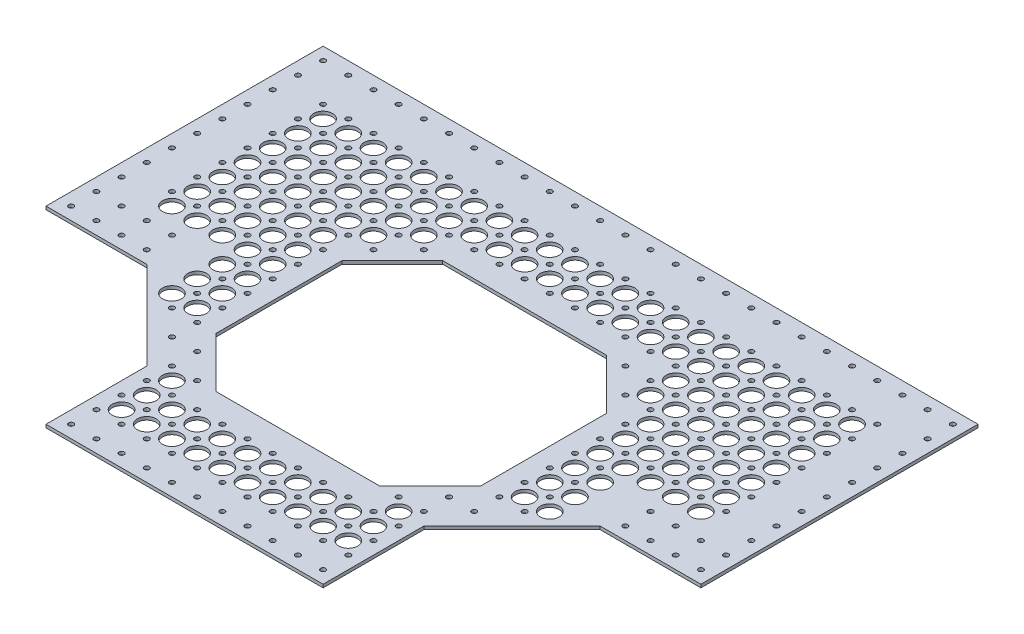
from build123d import *

# Parameters (mm, degrees)
SKETCH1_R           = 2.54
BOSS_EXTRUDE1_DEPTH = 3.175
SKETCH2_W           = 762
SKETCH2_H           = 25.4
CUT_EXTRUDE1_DEPTH  = 241.3
SKETCH3_W           = 266.7
SKETCH3_H           = 177.8
CUT_EXTRUDE2_DEPTH  = 3.175
BOSS_EXTRUDE2_DEPTH = 3.175
CUT_EXTRUDE3_DEPTH  = 3.175
SKETCH8_R           = 2.54
SKETCH8_R_2         = 9.525
CUT_EXTRUDE5_DEPTH  = 3.175


with BuildPart() as part:
    # Sketch1 → Boss-Extrude1 (new body)
    with BuildSketch(Plane(origin=(0, 0, 0), x_dir=(1, 0, 0), z_dir=(0, 1, 0))):
        Polygon((0, 101.6), (0, 0), (-88.904535599, -88.904535599), (-177.804535599, -88.904535599), (-190.504535599, -88.904535599), (-190.504535599, -419.104535599), (-177.804535599, -419.104535599), (-88.904535599, -419.104535599), (0, -508.009071197), (0, -609.609071197), (279.4, -609.609071197), (279.4, -508.009071197), (368.304535599, -419.104535599), (469.904535599, -419.104535599), (469.904535599, -88.904535599), (368.304535599, -88.904535599), (279.4, 0), (279.4, 101.6), align=None)
        with Locations((12.7, -596.909071197)):
            Circle(SKETCH1_R, mode=Mode.SUBTRACT)
        with Locations((38.1, -596.909071197)):
            Circle(SKETCH1_R, mode=Mode.SUBTRACT)
        with Locations((63.5, -596.909071197)):
            Circle(SKETCH1_R, mode=Mode.SUBTRACT)
        with Locations((88.9, -596.909071197)):
            Circle(SKETCH1_R, mode=Mode.SUBTRACT)
        with Locations((114.3, -596.909071197)):
            Circle(SKETCH1_R, mode=Mode.SUBTRACT)
        with Locations((139.7, -596.909071197)):
            Circle(SKETCH1_R, mode=Mode.SUBTRACT)
        with Locations((-177.804535599, -406.404535599)):
            Circle(SKETCH1_R, mode=Mode.SUBTRACT)
        with Locations((-152.404535599, -406.404535599)):
            Circle(SKETCH1_R, mode=Mode.SUBTRACT)
        with Locations((-127.004535599, -406.404535599)):
            Circle(SKETCH1_R, mode=Mode.SUBTRACT)
        with Locations((-177.804535599, -381.004535599)):
            Circle(SKETCH1_R, mode=Mode.SUBTRACT)
        with Locations((-152.404535599, -381.004535599)):
            Circle(SKETCH1_R, mode=Mode.SUBTRACT)
        with Locations((-177.804535599, -355.604535599)):
            Circle(SKETCH1_R, mode=Mode.SUBTRACT)
        with Locations((-127.004535599, -381.004535599)):
            Circle(SKETCH1_R, mode=Mode.SUBTRACT)
        with Locations((-101.604535599, -406.404535599)):
            Circle(SKETCH1_R, mode=Mode.SUBTRACT)
        with Locations((-101.604535599, -381.004535599)):
            Circle(SKETCH1_R, mode=Mode.SUBTRACT)
        with Locations((-177.804535599, -330.204535599)):
            Circle(SKETCH1_R, mode=Mode.SUBTRACT)
        with Locations((-177.804535599, -304.804535599)):
            Circle(SKETCH1_R, mode=Mode.SUBTRACT)
        with Locations((-177.804535599, -279.404535599)):
            Circle(SKETCH1_R, mode=Mode.SUBTRACT)
        with Locations((165.1, -596.909071197)):
            Circle(SKETCH1_R, mode=Mode.SUBTRACT)
        with Locations((190.5, -596.909071197)):
            Circle(SKETCH1_R, mode=Mode.SUBTRACT)
        with Locations((215.9, -596.909071197)):
            Circle(SKETCH1_R, mode=Mode.SUBTRACT)
        with Locations((241.3, -596.909071197)):
            Circle(SKETCH1_R, mode=Mode.SUBTRACT)
        with Locations((266.7, -596.909071197)):
            Circle(SKETCH1_R, mode=Mode.SUBTRACT)
        with Locations((381.004535599, -406.404535599)):
            Circle(SKETCH1_R, mode=Mode.SUBTRACT)
        with Locations((381.004535599, -381.004535599)):
            Circle(SKETCH1_R, mode=Mode.SUBTRACT)
        with Locations((406.404535599, -406.404535599)):
            Circle(SKETCH1_R, mode=Mode.SUBTRACT)
        with Locations((431.804535599, -406.404535599)):
            Circle(SKETCH1_R, mode=Mode.SUBTRACT)
        with Locations((457.204535599, -406.404535599)):
            Circle(SKETCH1_R, mode=Mode.SUBTRACT)
        with Locations((406.404535599, -381.004535599)):
            Circle(SKETCH1_R, mode=Mode.SUBTRACT)
        with Locations((431.804535599, -381.004535599)):
            Circle(SKETCH1_R, mode=Mode.SUBTRACT)
        with Locations((457.204535599, -381.004535599)):
            Circle(SKETCH1_R, mode=Mode.SUBTRACT)
        with Locations((457.204535599, -355.604535599)):
            Circle(SKETCH1_R, mode=Mode.SUBTRACT)
        with Locations((457.204535599, -330.204535599)):
            Circle(SKETCH1_R, mode=Mode.SUBTRACT)
        with Locations((457.204535599, -304.804535599)):
            Circle(SKETCH1_R, mode=Mode.SUBTRACT)
        with Locations((457.204535599, -279.404535599)):
            Circle(SKETCH1_R, mode=Mode.SUBTRACT)
        with Locations((-177.804535599, -254.004535599)):
            Circle(SKETCH1_R, mode=Mode.SUBTRACT)
        with Locations((-177.804535599, -228.604535599)):
            Circle(SKETCH1_R, mode=Mode.SUBTRACT)
        with Locations((-177.804535599, -203.204535599)):
            Circle(SKETCH1_R, mode=Mode.SUBTRACT)
        with Locations((-177.804535599, -177.804535599)):
            Circle(SKETCH1_R, mode=Mode.SUBTRACT)
        with Locations((-177.804535599, -152.404535599)):
            Circle(SKETCH1_R, mode=Mode.SUBTRACT)
        with Locations((-152.404535599, -152.404535599)):
            Circle(SKETCH1_R, mode=Mode.SUBTRACT)
        with Locations((-177.804535599, -127.004535599)):
            Circle(SKETCH1_R, mode=Mode.SUBTRACT)
        with Locations((-152.404535599, -127.004535599)):
            Circle(SKETCH1_R, mode=Mode.SUBTRACT)
        with Locations((-127.004535599, -152.404535599)):
            Circle(SKETCH1_R, mode=Mode.SUBTRACT)
        with Locations((-127.004535599, -127.004535599)):
            Circle(SKETCH1_R, mode=Mode.SUBTRACT)
        with Locations((-177.804535599, -101.604535599)):
            Circle(SKETCH1_R, mode=Mode.SUBTRACT)
        with Locations((-101.604535599, -152.404535599)):
            Circle(SKETCH1_R, mode=Mode.SUBTRACT)
        with Locations((-76.204535599, -152.404535599)):
            Circle(SKETCH1_R, mode=Mode.SUBTRACT)
        with Locations((-101.604535599, -127.004535599)):
            Circle(SKETCH1_R, mode=Mode.SUBTRACT)
        with Locations((-76.204535599, -127.004535599)):
            Circle(SKETCH1_R, mode=Mode.SUBTRACT)
        with Locations((-50.804535599, -152.404535599)):
            Circle(SKETCH1_R, mode=Mode.SUBTRACT)
        with Locations((-25.404535599, -152.404535599)):
            Circle(SKETCH1_R, mode=Mode.SUBTRACT)
        with Locations((-50.804535599, -127.004535599)):
            Circle(SKETCH1_R, mode=Mode.SUBTRACT)
        with Locations((-25.404535599, -127.004535599)):
            Circle(SKETCH1_R, mode=Mode.SUBTRACT)
        with Locations((-0.004535599, -152.404535599)):
            Circle(SKETCH1_R, mode=Mode.SUBTRACT)
        with Locations((-0.004535599, -127.004535599)):
            Circle(SKETCH1_R, mode=Mode.SUBTRACT)
        with Locations((25.395464401, -152.404535599)):
            Circle(SKETCH1_R, mode=Mode.SUBTRACT)
        with Locations((50.795464401, -152.404535599)):
            Circle(SKETCH1_R, mode=Mode.SUBTRACT)
        with Locations((25.395464401, -127.004535599)):
            Circle(SKETCH1_R, mode=Mode.SUBTRACT)
        with Locations((50.795464401, -127.004535599)):
            Circle(SKETCH1_R, mode=Mode.SUBTRACT)
        with Locations((76.195464401, -152.404535599)):
            Circle(SKETCH1_R, mode=Mode.SUBTRACT)
        with Locations((76.195464401, -127.004535599)):
            Circle(SKETCH1_R, mode=Mode.SUBTRACT)
        with Locations((101.595464401, -152.404535599)):
            Circle(SKETCH1_R, mode=Mode.SUBTRACT)
        with Locations((126.995464401, -152.404535599)):
            Circle(SKETCH1_R, mode=Mode.SUBTRACT)
        with Locations((101.595464401, -127.004535599)):
            Circle(SKETCH1_R, mode=Mode.SUBTRACT)
        with Locations((126.995464401, -127.004535599)):
            Circle(SKETCH1_R, mode=Mode.SUBTRACT)
        with Locations((12.7, 88.9)):
            Circle(SKETCH1_R, mode=Mode.SUBTRACT)
        with Locations((38.1, 88.9)):
            Circle(SKETCH1_R, mode=Mode.SUBTRACT)
        with Locations((63.5, 88.9)):
            Circle(SKETCH1_R, mode=Mode.SUBTRACT)
        with Locations((88.9, 88.9)):
            Circle(SKETCH1_R, mode=Mode.SUBTRACT)
        with Locations((114.3, 88.9)):
            Circle(SKETCH1_R, mode=Mode.SUBTRACT)
        with Locations((139.7, 88.9)):
            Circle(SKETCH1_R, mode=Mode.SUBTRACT)
        with Locations((152.395464401, -152.404535599)):
            Circle(SKETCH1_R, mode=Mode.SUBTRACT)
        with Locations((177.795464401, -152.404535599)):
            Circle(SKETCH1_R, mode=Mode.SUBTRACT)
        with Locations((152.395464401, -127.004535599)):
            Circle(SKETCH1_R, mode=Mode.SUBTRACT)
        with Locations((177.795464401, -127.004535599)):
            Circle(SKETCH1_R, mode=Mode.SUBTRACT)
        with Locations((203.195464401, -152.404535599)):
            Circle(SKETCH1_R, mode=Mode.SUBTRACT)
        with Locations((203.195464401, -127.004535599)):
            Circle(SKETCH1_R, mode=Mode.SUBTRACT)
        with Locations((228.595464401, -152.404535599)):
            Circle(SKETCH1_R, mode=Mode.SUBTRACT)
        with Locations((253.995464401, -152.404535599)):
            Circle(SKETCH1_R, mode=Mode.SUBTRACT)
        with Locations((228.595464401, -127.004535599)):
            Circle(SKETCH1_R, mode=Mode.SUBTRACT)
        with Locations((253.995464401, -127.004535599)):
            Circle(SKETCH1_R, mode=Mode.SUBTRACT)
        with Locations((279.395464401, -152.404535599)):
            Circle(SKETCH1_R, mode=Mode.SUBTRACT)
        with Locations((304.795464401, -152.404535599)):
            Circle(SKETCH1_R, mode=Mode.SUBTRACT)
        with Locations((279.395464401, -127.004535599)):
            Circle(SKETCH1_R, mode=Mode.SUBTRACT)
        with Locations((304.795464401, -127.004535599)):
            Circle(SKETCH1_R, mode=Mode.SUBTRACT)
        with Locations((457.204535599, -254.004535599)):
            Circle(SKETCH1_R, mode=Mode.SUBTRACT)
        with Locations((457.204535599, -228.604535599)):
            Circle(SKETCH1_R, mode=Mode.SUBTRACT)
        with Locations((457.204535599, -203.204535599)):
            Circle(SKETCH1_R, mode=Mode.SUBTRACT)
        with Locations((457.204535599, -177.804535599)):
            Circle(SKETCH1_R, mode=Mode.SUBTRACT)
        with Locations((330.195464401, -152.404535599)):
            Circle(SKETCH1_R, mode=Mode.SUBTRACT)
        with Locations((330.195464401, -127.004535599)):
            Circle(SKETCH1_R, mode=Mode.SUBTRACT)
        with Locations((355.595464401, -152.404535599)):
            Circle(SKETCH1_R, mode=Mode.SUBTRACT)
        with Locations((380.995464401, -152.404535599)):
            Circle(SKETCH1_R, mode=Mode.SUBTRACT)
        with Locations((355.595464401, -127.004535599)):
            Circle(SKETCH1_R, mode=Mode.SUBTRACT)
        with Locations((380.995464401, -127.004535599)):
            Circle(SKETCH1_R, mode=Mode.SUBTRACT)
        with Locations((406.395464401, -152.404535599)):
            Circle(SKETCH1_R, mode=Mode.SUBTRACT)
        with Locations((406.395464401, -127.004535599)):
            Circle(SKETCH1_R, mode=Mode.SUBTRACT)
        with Locations((431.795464401, -152.404535599)):
            Circle(SKETCH1_R, mode=Mode.SUBTRACT)
        with Locations((457.204535599, -152.404535599)):
            Circle(SKETCH1_R, mode=Mode.SUBTRACT)
        with Locations((431.795464401, -127.004535599)):
            Circle(SKETCH1_R, mode=Mode.SUBTRACT)
        with Locations((457.204535599, -127.004535599)):
            Circle(SKETCH1_R, mode=Mode.SUBTRACT)
        with Locations((457.204535599, -101.604535599)):
            Circle(SKETCH1_R, mode=Mode.SUBTRACT)
        with Locations((165.1, 88.9)):
            Circle(SKETCH1_R, mode=Mode.SUBTRACT)
        with Locations((190.5, 88.9)):
            Circle(SKETCH1_R, mode=Mode.SUBTRACT)
        with Locations((215.9, 88.9)):
            Circle(SKETCH1_R, mode=Mode.SUBTRACT)
        with Locations((241.3, 88.9)):
            Circle(SKETCH1_R, mode=Mode.SUBTRACT)
        with Locations((266.7, 88.9)):
            Circle(SKETCH1_R, mode=Mode.SUBTRACT)
    extrude(amount=BOSS_EXTRUDE1_DEPTH)

    # Sketch2 → Cut-Extrude1 (cut)
    with BuildSketch(Plane(origin=(0, 0, -101.6), x_dir=(-1, 0, 0), z_dir=(0, 0, -1))):
        with Locations((-129.535464401, 0)):
            Rectangle(SKETCH2_W, SKETCH2_H)
    extrude(amount=-CUT_EXTRUDE1_DEPTH, mode=Mode.SUBTRACT)

    # Sketch3 → Cut-Extrude2 (cut)
    with BuildSketch(Plane(origin=(0, 3.175, 0), x_dir=(1, 0, 0), z_dir=(0, 1, 0))):
        with Locations((139.7, -406.404535599)):
            Rectangle(SKETCH3_W, SKETCH3_H)
    extrude(amount=-CUT_EXTRUDE2_DEPTH, mode=Mode.SUBTRACT)

    # Sketch4 → Boss-Extrude2 (add)
    with BuildSketch(Plane(origin=(0, 3.175, 0), x_dir=(1, 0, 0), z_dir=(0, 1, 0))):
        Polygon((222.25, -495.304535599), (273.05, -444.504535599), (273.05, -495.304535599), align=None)
        Polygon((6.35, -495.304535599), (6.35, -444.504535599), (57.15, -495.304535599), align=None)
    extrude(amount=-BOSS_EXTRUDE2_DEPTH)

    # Sketch7 → Cut-Extrude3 (cut)
    with BuildSketch(Plane(origin=(0, 3.175, 0), x_dir=(1, 0, 0), z_dir=(0, 1, 0))):
        Polygon((6.35, -317.504535599), (57.15, -266.704535599), (222.25, -266.704535599), (273.05, -317.504535599), align=None)
    extrude(amount=-CUT_EXTRUDE3_DEPTH, mode=Mode.SUBTRACT)

    # Sketch8 → Cut-Extrude5 (cut)
    with BuildSketch(Plane(origin=(0, 3.175, 0), x_dir=(1, 0, 0), z_dir=(0, 1, 0))):
        with Locations((12.7, -596.909071197)):
            Circle(SKETCH8_R)
        with Locations((12.7, -571.509071197)):
            Circle(SKETCH8_R)
        with Locations((12.7, -546.109071197)):
            Circle(SKETCH8_R)
        with Locations((12.7, -520.709071197)):
            Circle(SKETCH8_R)
        with Locations((12.7, -495.309071197)):
            Circle(SKETCH8_R)
        with Locations((12.7, -469.909071197)):
            Circle(SKETCH8_R)
        with Locations((12.7, -292.109071197)):
            Circle(SKETCH8_R)
        with Locations((12.7, -266.709071197)):
            Circle(SKETCH8_R)
        with Locations((12.7, -241.309071197)):
            Circle(SKETCH8_R)
        with Locations((12.7, -215.909071197)):
            Circle(SKETCH8_R)
        with Locations((12.7, -190.509071197)):
            Circle(SKETCH8_R)
        with Locations((38.1, -190.509071197)):
            Circle(SKETCH8_R)
        with Locations((38.1, -215.909071197)):
            Circle(SKETCH8_R)
        with Locations((38.1, -241.309071197)):
            Circle(SKETCH8_R)
        with Locations((38.1, -266.709071197)):
            Circle(SKETCH8_R)
        with Locations((38.1, -495.309071197)):
            Circle(SKETCH8_R)
        with Locations((38.1, -520.709071197)):
            Circle(SKETCH8_R)
        with Locations((38.1, -546.109071197)):
            Circle(SKETCH8_R)
        with Locations((38.1, -571.509071197)):
            Circle(SKETCH8_R)
        with Locations((63.5, -190.509071197)):
            Circle(SKETCH8_R)
        with Locations((63.5, -215.909071197)):
            Circle(SKETCH8_R)
        with Locations((63.5, -241.309071197)):
            Circle(SKETCH8_R)
        with Locations((63.5, -520.709071197)):
            Circle(SKETCH8_R)
        with Locations((63.5, -546.109071197)):
            Circle(SKETCH8_R)
        with Locations((63.5, -571.509071197)):
            Circle(SKETCH8_R)
        with Locations((88.9, -190.509071197)):
            Circle(SKETCH8_R)
        with Locations((88.9, -215.909071197)):
            Circle(SKETCH8_R)
        with Locations((88.9, -241.309071197)):
            Circle(SKETCH8_R)
        with Locations((88.9, -520.709071197)):
            Circle(SKETCH8_R)
        with Locations((88.9, -546.109071197)):
            Circle(SKETCH8_R)
        with Locations((88.9, -571.509071197)):
            Circle(SKETCH8_R)
        with Locations((114.3, -190.509071197)):
            Circle(SKETCH8_R)
        with Locations((114.3, -215.909071197)):
            Circle(SKETCH8_R)
        with Locations((114.3, -241.309071197)):
            Circle(SKETCH8_R)
        with Locations((114.3, -520.709071197)):
            Circle(SKETCH8_R)
        with Locations((114.3, -546.109071197)):
            Circle(SKETCH8_R)
        with Locations((114.3, -571.509071197)):
            Circle(SKETCH8_R)
        with Locations((139.7, -190.509071197)):
            Circle(SKETCH8_R)
        with Locations((139.7, -215.909071197)):
            Circle(SKETCH8_R)
        with Locations((139.7, -241.309071197)):
            Circle(SKETCH8_R)
        with Locations((139.7, -520.709071197)):
            Circle(SKETCH8_R)
        with Locations((139.7, -546.109071197)):
            Circle(SKETCH8_R)
        with Locations((139.7, -571.509071197)):
            Circle(SKETCH8_R)
        with Locations((165.1, -190.509071197)):
            Circle(SKETCH8_R)
        with Locations((165.1, -215.909071197)):
            Circle(SKETCH8_R)
        with Locations((165.1, -241.309071197)):
            Circle(SKETCH8_R)
        with Locations((165.1, -520.709071197)):
            Circle(SKETCH8_R)
        with Locations((165.1, -546.109071197)):
            Circle(SKETCH8_R)
        with Locations((165.1, -571.509071197)):
            Circle(SKETCH8_R)
        with Locations((190.5, -190.509071197)):
            Circle(SKETCH8_R)
        with Locations((190.5, -215.909071197)):
            Circle(SKETCH8_R)
        with Locations((190.5, -241.309071197)):
            Circle(SKETCH8_R)
        with Locations((190.5, -520.709071197)):
            Circle(SKETCH8_R)
        with Locations((190.5, -546.109071197)):
            Circle(SKETCH8_R)
        with Locations((190.5, -571.509071197)):
            Circle(SKETCH8_R)
        with Locations((215.9, -190.509071197)):
            Circle(SKETCH8_R)
        with Locations((215.9, -215.909071197)):
            Circle(SKETCH8_R)
        with Locations((215.9, -241.309071197)):
            Circle(SKETCH8_R)
        with Locations((215.9, -520.709071197)):
            Circle(SKETCH8_R)
        with Locations((215.9, -546.109071197)):
            Circle(SKETCH8_R)
        with Locations((215.9, -571.509071197)):
            Circle(SKETCH8_R)
        with Locations((241.3, -190.509071197)):
            Circle(SKETCH8_R)
        with Locations((241.3, -215.909071197)):
            Circle(SKETCH8_R)
        with Locations((241.3, -241.309071197)):
            Circle(SKETCH8_R)
        with Locations((241.3, -266.709071197)):
            Circle(SKETCH8_R)
        with Locations((241.3, -495.309071197)):
            Circle(SKETCH8_R)
        with Locations((241.3, -520.709071197)):
            Circle(SKETCH8_R)
        with Locations((241.3, -546.109071197)):
            Circle(SKETCH8_R)
        with Locations((241.3, -571.509071197)):
            Circle(SKETCH8_R)
        with Locations((266.7, -190.509071197)):
            Circle(SKETCH8_R)
        with Locations((266.7, -215.909071197)):
            Circle(SKETCH8_R)
        with Locations((266.7, -241.309071197)):
            Circle(SKETCH8_R)
        with Locations((266.7, -266.709071197)):
            Circle(SKETCH8_R)
        with Locations((266.7, -292.109071197)):
            Circle(SKETCH8_R)
        with Locations((266.7, -469.909071197)):
            Circle(SKETCH8_R)
        with Locations((266.7, -495.309071197)):
            Circle(SKETCH8_R)
        with Locations((266.7, -520.709071197)):
            Circle(SKETCH8_R)
        with Locations((266.7, -546.109071197)):
            Circle(SKETCH8_R)
        with Locations((266.7, -571.509071197)):
            Circle(SKETCH8_R)
        with Locations((292.1, -190.509071197)):
            Circle(SKETCH8_R)
        with Locations((292.1, -215.909071197)):
            Circle(SKETCH8_R)
        with Locations((292.1, -241.309071197)):
            Circle(SKETCH8_R)
        with Locations((292.1, -266.709071197)):
            Circle(SKETCH8_R)
        with Locations((292.1, -292.109071197)):
            Circle(SKETCH8_R)
        with Locations((292.1, -469.909071197)):
            Circle(SKETCH8_R)
        with Locations((317.5, -190.509071197)):
            Circle(SKETCH8_R)
        with Locations((317.5, -215.909071197)):
            Circle(SKETCH8_R)
        with Locations((317.5, -241.309071197)):
            Circle(SKETCH8_R)
        with Locations((317.5, -266.709071197)):
            Circle(SKETCH8_R)
        with Locations((317.5, -292.109071197)):
            Circle(SKETCH8_R)
        with Locations((342.9, -190.509071197)):
            Circle(SKETCH8_R)
        with Locations((342.9, -215.909071197)):
            Circle(SKETCH8_R)
        with Locations((342.9, -241.309071197)):
            Circle(SKETCH8_R)
        with Locations((342.9, -266.709071197)):
            Circle(SKETCH8_R)
        with Locations((342.9, -292.109071197)):
            Circle(SKETCH8_R)
        with Locations((368.3, -190.509071197)):
            Circle(SKETCH8_R)
        with Locations((368.3, -215.909071197)):
            Circle(SKETCH8_R)
        with Locations((368.3, -241.309071197)):
            Circle(SKETCH8_R)
        with Locations((368.3, -266.709071197)):
            Circle(SKETCH8_R)
        with Locations((368.3, -292.109071197)):
            Circle(SKETCH8_R)
        with Locations((393.7, -190.509071197)):
            Circle(SKETCH8_R)
        with Locations((393.7, -215.909071197)):
            Circle(SKETCH8_R)
        with Locations((393.7, -241.309071197)):
            Circle(SKETCH8_R)
        with Locations((393.7, -266.709071197)):
            Circle(SKETCH8_R)
        with Locations((393.7, -292.109071197)):
            Circle(SKETCH8_R)
        with Locations((419.1, -190.509071197)):
            Circle(SKETCH8_R)
        with Locations((419.1, -215.909071197)):
            Circle(SKETCH8_R)
        with Locations((419.1, -241.309071197)):
            Circle(SKETCH8_R)
        with Locations((419.1, -266.709071197)):
            Circle(SKETCH8_R)
        with Locations((419.1, -292.109071197)):
            Circle(SKETCH8_R)
        with Locations((-12.7, -190.509071197)):
            Circle(SKETCH8_R)
        with Locations((-12.7, -215.909071197)):
            Circle(SKETCH8_R)
        with Locations((-12.7, -241.309071197)):
            Circle(SKETCH8_R)
        with Locations((-12.7, -266.709071197)):
            Circle(SKETCH8_R)
        with Locations((-12.7, -292.109071197)):
            Circle(SKETCH8_R)
        with Locations((-12.7, -469.909071197)):
            Circle(SKETCH8_R)
        with Locations((-38.1, -190.509071197)):
            Circle(SKETCH8_R)
        with Locations((-38.1, -215.909071197)):
            Circle(SKETCH8_R)
        with Locations((-38.1, -241.309071197)):
            Circle(SKETCH8_R)
        with Locations((-38.1, -266.709071197)):
            Circle(SKETCH8_R)
        with Locations((-38.1, -292.109071197)):
            Circle(SKETCH8_R)
        with Locations((-63.5, -190.509071197)):
            Circle(SKETCH8_R)
        with Locations((-63.5, -215.909071197)):
            Circle(SKETCH8_R)
        with Locations((-63.5, -241.309071197)):
            Circle(SKETCH8_R)
        with Locations((-63.5, -266.709071197)):
            Circle(SKETCH8_R)
        with Locations((-63.5, -292.109071197)):
            Circle(SKETCH8_R)
        with Locations((-88.9, -190.509071197)):
            Circle(SKETCH8_R)
        with Locations((-88.9, -215.909071197)):
            Circle(SKETCH8_R)
        with Locations((-88.9, -241.309071197)):
            Circle(SKETCH8_R)
        with Locations((-88.9, -266.709071197)):
            Circle(SKETCH8_R)
        with Locations((-88.9, -292.109071197)):
            Circle(SKETCH8_R)
        with Locations((-114.3, -190.509071197)):
            Circle(SKETCH8_R)
        with Locations((-114.3, -215.909071197)):
            Circle(SKETCH8_R)
        with Locations((-114.3, -241.309071197)):
            Circle(SKETCH8_R)
        with Locations((-114.3, -266.709071197)):
            Circle(SKETCH8_R)
        with Locations((-114.3, -292.109071197)):
            Circle(SKETCH8_R)
        with Locations((-139.7, -190.509071197)):
            Circle(SKETCH8_R)
        with Locations((-139.7, -215.909071197)):
            Circle(SKETCH8_R)
        with Locations((-139.7, -241.309071197)):
            Circle(SKETCH8_R)
        with Locations((-139.7, -266.709071197)):
            Circle(SKETCH8_R)
        with Locations((-139.7, -292.109071197)):
            Circle(SKETCH8_R)
        with Locations((-127.004535599, -203.2)):
            Circle(SKETCH8_R_2)
        with Locations((-101.604535599, -203.2)):
            Circle(SKETCH8_R_2)
        with Locations((-76.204535599, -203.2)):
            Circle(SKETCH8_R_2)
        with Locations((-50.804535599, -203.2)):
            Circle(SKETCH8_R_2)
        with Locations((-25.404535599, -203.2)):
            Circle(SKETCH8_R_2)
        with Locations((-0.004535599, -203.2)):
            Circle(SKETCH8_R_2)
        with Locations((25.395464401, -203.2)):
            Circle(SKETCH8_R_2)
        with Locations((50.795464401, -203.2)):
            Circle(SKETCH8_R_2)
        with Locations((76.195464401, -203.2)):
            Circle(SKETCH8_R_2)
        with Locations((101.595464401, -203.2)):
            Circle(SKETCH8_R_2)
        with Locations((126.995464401, -203.2)):
            Circle(SKETCH8_R_2)
        with Locations((152.395464401, -203.2)):
            Circle(SKETCH8_R_2)
        with Locations((177.795464401, -203.2)):
            Circle(SKETCH8_R_2)
        with Locations((203.195464401, -203.2)):
            Circle(SKETCH8_R_2)
        with Locations((228.595464401, -203.2)):
            Circle(SKETCH8_R_2)
        with Locations((253.995464401, -203.2)):
            Circle(SKETCH8_R_2)
        with Locations((279.395464401, -203.2)):
            Circle(SKETCH8_R_2)
        with Locations((304.795464401, -203.2)):
            Circle(SKETCH8_R_2)
        with Locations((330.195464401, -203.2)):
            Circle(SKETCH8_R_2)
        with Locations((355.595464401, -203.2)):
            Circle(SKETCH8_R_2)
        with Locations((380.995464401, -203.2)):
            Circle(SKETCH8_R_2)
        with Locations((406.395464401, -203.2)):
            Circle(SKETCH8_R_2)
        with Locations((-101.604535599, -228.6)):
            Circle(SKETCH8_R_2)
        with Locations((-76.204535599, -228.6)):
            Circle(SKETCH8_R_2)
        with Locations((-50.804535599, -228.6)):
            Circle(SKETCH8_R_2)
        with Locations((-25.404535599, -228.6)):
            Circle(SKETCH8_R_2)
        with Locations((-0.004535599, -228.6)):
            Circle(SKETCH8_R_2)
        with Locations((25.395464401, -228.6)):
            Circle(SKETCH8_R_2)
        with Locations((50.795464401, -228.6)):
            Circle(SKETCH8_R_2)
        with Locations((76.195464401, -228.6)):
            Circle(SKETCH8_R_2)
        with Locations((101.595464401, -228.6)):
            Circle(SKETCH8_R_2)
        with Locations((126.995464401, -228.6)):
            Circle(SKETCH8_R_2)
        with Locations((152.395464401, -228.6)):
            Circle(SKETCH8_R_2)
        with Locations((177.795464401, -228.6)):
            Circle(SKETCH8_R_2)
        with Locations((203.195464401, -228.6)):
            Circle(SKETCH8_R_2)
        with Locations((228.595464401, -228.6)):
            Circle(SKETCH8_R_2)
        with Locations((253.995464401, -228.6)):
            Circle(SKETCH8_R_2)
        with Locations((279.395464401, -228.6)):
            Circle(SKETCH8_R_2)
        with Locations((304.795464401, -228.6)):
            Circle(SKETCH8_R_2)
        with Locations((330.195464401, -228.6)):
            Circle(SKETCH8_R_2)
        with Locations((355.595464401, -228.6)):
            Circle(SKETCH8_R_2)
        with Locations((380.995464401, -228.6)):
            Circle(SKETCH8_R_2)
        with Locations((406.395464401, -228.6)):
            Circle(SKETCH8_R_2)
        with Locations((-101.604535599, -254)):
            Circle(SKETCH8_R_2)
        with Locations((-76.204535599, -254)):
            Circle(SKETCH8_R_2)
        with Locations((-50.804535599, -254)):
            Circle(SKETCH8_R_2)
        with Locations((-25.404535599, -254)):
            Circle(SKETCH8_R_2)
        with Locations((-0.004535599, -254)):
            Circle(SKETCH8_R_2)
        with Locations((25.395464401, -254)):
            Circle(SKETCH8_R_2)
        with Locations((-139.7, -317.509071197)):
            Circle(SKETCH8_R)
        with Locations((-114.3, -317.509071197)):
            Circle(SKETCH8_R)
        with Locations((-88.9, -317.509071197)):
            Circle(SKETCH8_R)
        with Locations((-63.5, -317.509071197)):
            Circle(SKETCH8_R)
        with Locations((-38.1, -317.509071197)):
            Circle(SKETCH8_R)
        with Locations((-12.7, -317.509071197)):
            Circle(SKETCH8_R)
        with Locations((-139.7, -342.909071197)):
            Circle(SKETCH8_R)
        with Locations((-114.3, -342.909071197)):
            Circle(SKETCH8_R)
        with Locations((-88.9, -342.909071197)):
            Circle(SKETCH8_R)
        with Locations((-63.5, -342.909071197)):
            Circle(SKETCH8_R)
        with Locations((-38.1, -342.909071197)):
            Circle(SKETCH8_R)
        with Locations((-12.7, -342.909071197)):
            Circle(SKETCH8_R)
        with Locations((-38.1, -368.309071197)):
            Circle(SKETCH8_R)
        with Locations((-12.7, -368.309071197)):
            Circle(SKETCH8_R)
        with Locations((-38.1, -393.709071197)):
            Circle(SKETCH8_R)
        with Locations((-12.7, -393.709071197)):
            Circle(SKETCH8_R)
        with Locations((-38.1, -419.109071197)):
            Circle(SKETCH8_R)
        with Locations((-12.7, -419.109071197)):
            Circle(SKETCH8_R)
        with Locations((-38.1, -444.509071197)):
            Circle(SKETCH8_R)
        with Locations((-12.7, -444.509071197)):
            Circle(SKETCH8_R)
        with Locations((292.1, -317.509071197)):
            Circle(SKETCH8_R)
        with Locations((317.5, -317.509071197)):
            Circle(SKETCH8_R)
        with Locations((342.9, -317.509071197)):
            Circle(SKETCH8_R)
        with Locations((368.3, -317.509071197)):
            Circle(SKETCH8_R)
        with Locations((393.7, -317.509071197)):
            Circle(SKETCH8_R)
        with Locations((419.1, -317.509071197)):
            Circle(SKETCH8_R)
        with Locations((292.1, -342.909071197)):
            Circle(SKETCH8_R)
        with Locations((317.5, -342.909071197)):
            Circle(SKETCH8_R)
        with Locations((342.9, -342.909071197)):
            Circle(SKETCH8_R)
        with Locations((368.3, -342.909071197)):
            Circle(SKETCH8_R)
        with Locations((393.7, -342.909071197)):
            Circle(SKETCH8_R)
        with Locations((419.1, -342.909071197)):
            Circle(SKETCH8_R)
        with Locations((292.1, -368.309071197)):
            Circle(SKETCH8_R)
        with Locations((317.5, -368.309071197)):
            Circle(SKETCH8_R)
        with Locations((292.1, -393.709071197)):
            Circle(SKETCH8_R)
        with Locations((317.5, -393.709071197)):
            Circle(SKETCH8_R)
        with Locations((292.1, -419.109071197)):
            Circle(SKETCH8_R)
        with Locations((317.5, -419.109071197)):
            Circle(SKETCH8_R)
        with Locations((292.1, -444.509071197)):
            Circle(SKETCH8_R)
        with Locations((317.5, -444.509071197)):
            Circle(SKETCH8_R)
        with Locations((101.595464401, -533.4)):
            Circle(SKETCH8_R_2)
        with Locations((126.995464401, -533.4)):
            Circle(SKETCH8_R_2)
        with Locations((152.395464401, -533.4)):
            Circle(SKETCH8_R_2)
        with Locations((177.795464401, -533.4)):
            Circle(SKETCH8_R_2)
        with Locations((203.195464401, -533.4)):
            Circle(SKETCH8_R_2)
        with Locations((228.595464401, -533.4)):
            Circle(SKETCH8_R_2)
        with Locations((279.395464401, -254)):
            Circle(SKETCH8_R_2)
        with Locations((304.795464401, -254)):
            Circle(SKETCH8_R_2)
        with Locations((330.195464401, -254)):
            Circle(SKETCH8_R_2)
        with Locations((355.595464401, -254)):
            Circle(SKETCH8_R_2)
        with Locations((380.995464401, -254)):
            Circle(SKETCH8_R_2)
        with Locations((406.395464401, -254)):
            Circle(SKETCH8_R_2)
        with Locations((-101.604535599, -279.4)):
            Circle(SKETCH8_R_2)
        with Locations((-76.204535599, -279.4)):
            Circle(SKETCH8_R_2)
        with Locations((-50.804535599, -279.4)):
            Circle(SKETCH8_R_2)
        with Locations((-25.404535599, -279.4)):
            Circle(SKETCH8_R_2)
        with Locations((-0.004535599, -279.4)):
            Circle(SKETCH8_R_2)
        with Locations((304.795464401, -279.4)):
            Circle(SKETCH8_R_2)
        with Locations((330.195464401, -279.4)):
            Circle(SKETCH8_R_2)
        with Locations((355.595464401, -279.4)):
            Circle(SKETCH8_R_2)
        with Locations((380.995464401, -279.4)):
            Circle(SKETCH8_R_2)
        with Locations((406.395464401, -279.4)):
            Circle(SKETCH8_R_2)
        with Locations((-101.604535599, -304.8)):
            Circle(SKETCH8_R_2)
        with Locations((-76.204535599, -304.8)):
            Circle(SKETCH8_R_2)
        with Locations((-50.804535599, -304.8)):
            Circle(SKETCH8_R_2)
        with Locations((-25.404535599, -304.8)):
            Circle(SKETCH8_R_2)
        with Locations((330.195464401, -304.8)):
            Circle(SKETCH8_R_2)
        with Locations((355.595464401, -304.8)):
            Circle(SKETCH8_R_2)
        with Locations((380.995464401, -304.8)):
            Circle(SKETCH8_R_2)
        with Locations((406.395464401, -304.8)):
            Circle(SKETCH8_R_2)
        with Locations((-101.604535599, -330.2)):
            Circle(SKETCH8_R_2)
        with Locations((-76.204535599, -330.2)):
            Circle(SKETCH8_R_2)
        with Locations((-50.804535599, -330.2)):
            Circle(SKETCH8_R_2)
        with Locations((-25.404535599, -330.2)):
            Circle(SKETCH8_R_2)
        with Locations((330.195464401, -330.2)):
            Circle(SKETCH8_R_2)
        with Locations((355.595464401, -330.2)):
            Circle(SKETCH8_R_2)
        with Locations((380.995464401, -330.2)):
            Circle(SKETCH8_R_2)
        with Locations((406.395464401, -330.2)):
            Circle(SKETCH8_R_2)
        with Locations((-101.604535599, -355.6)):
            Circle(SKETCH8_R_2)
        with Locations((-76.204535599, -355.6)):
            Circle(SKETCH8_R_2)
        with Locations((-50.804535599, -355.6)):
            Circle(SKETCH8_R_2)
        with Locations((-25.404535599, -355.6)):
            Circle(SKETCH8_R_2)
        with Locations((330.195464401, -355.6)):
            Circle(SKETCH8_R_2)
        with Locations((355.595464401, -355.6)):
            Circle(SKETCH8_R_2)
        with Locations((380.995464401, -355.6)):
            Circle(SKETCH8_R_2)
        with Locations((406.395464401, -355.6)):
            Circle(SKETCH8_R_2)
        with Locations((-25.404535599, -381)):
            Circle(SKETCH8_R_2)
        with Locations((330.195464401, -381)):
            Circle(SKETCH8_R_2)
        with Locations((-25.404535599, -406.4)):
            Circle(SKETCH8_R_2)
        with Locations((330.195464401, -406.4)):
            Circle(SKETCH8_R_2)
        with Locations((-25.404535599, -431.8)):
            Circle(SKETCH8_R_2)
        with Locations((330.195464401, -431.8)):
            Circle(SKETCH8_R_2)
        with Locations((50.795464401, -533.4)):
            Circle(SKETCH8_R_2)
        with Locations((76.195464401, -533.4)):
            Circle(SKETCH8_R_2)
        with Locations((50.795464401, -558.8)):
            Circle(SKETCH8_R_2)
        with Locations((76.195464401, -558.8)):
            Circle(SKETCH8_R_2)
        with Locations((101.595464401, -558.8)):
            Circle(SKETCH8_R_2)
        with Locations((126.995464401, -558.8)):
            Circle(SKETCH8_R_2)
        with Locations((152.395464401, -558.8)):
            Circle(SKETCH8_R_2)
        with Locations((177.795464401, -558.8)):
            Circle(SKETCH8_R_2)
        with Locations((203.195464401, -558.8)):
            Circle(SKETCH8_R_2)
        with Locations((228.595464401, -558.8)):
            Circle(SKETCH8_R_2)
        with Locations((-50.804535599, -381)):
            Circle(SKETCH8_R_2)
        with Locations((-127.004535599, -228.6)):
            Circle(SKETCH8_R_2)
        with Locations((-127.004535599, -254)):
            Circle(SKETCH8_R_2)
        with Locations((-127.004535599, -279.4)):
            Circle(SKETCH8_R_2)
        with Locations((-127.004535599, -304.8)):
            Circle(SKETCH8_R_2)
        with Locations((-127.004535599, -330.2)):
            Circle(SKETCH8_R_2)
        with Locations((-127.004535599, -355.6)):
            Circle(SKETCH8_R_2)
        with Locations((-50.804535599, -406.4)):
            Circle(SKETCH8_R_2)
        with Locations((-50.804535599, -431.8)):
            Circle(SKETCH8_R_2)
        with Locations((25.395464401, -533.4)):
            Circle(SKETCH8_R_2)
        with Locations((25.395464401, -558.8)):
            Circle(SKETCH8_R_2)
        with Locations((253.995464401, -533.4)):
            Circle(SKETCH8_R_2)
        with Locations((253.995464401, -558.8)):
            Circle(SKETCH8_R_2)
        with Locations((25.395464401, -508)):
            Circle(SKETCH8_R_2)
        with Locations((253.995464401, -508)):
            Circle(SKETCH8_R_2)
        with Locations((304.795464401, -431.8)):
            Circle(SKETCH8_R_2)
        with Locations((304.795464401, -406.4)):
            Circle(SKETCH8_R_2)
        with Locations((304.795464401, -381)):
            Circle(SKETCH8_R_2)
        with Locations((304.795464401, -355.6)):
            Circle(SKETCH8_R_2)
        with Locations((304.795464401, -330.2)):
            Circle(SKETCH8_R_2)
        with Locations((304.795464401, -304.8)):
            Circle(SKETCH8_R_2)
        with Locations((279.395464401, -279.4)):
            Circle(SKETCH8_R_2)
    extrude(amount=-CUT_EXTRUDE5_DEPTH, mode=Mode.SUBTRACT)


solid = part.part
